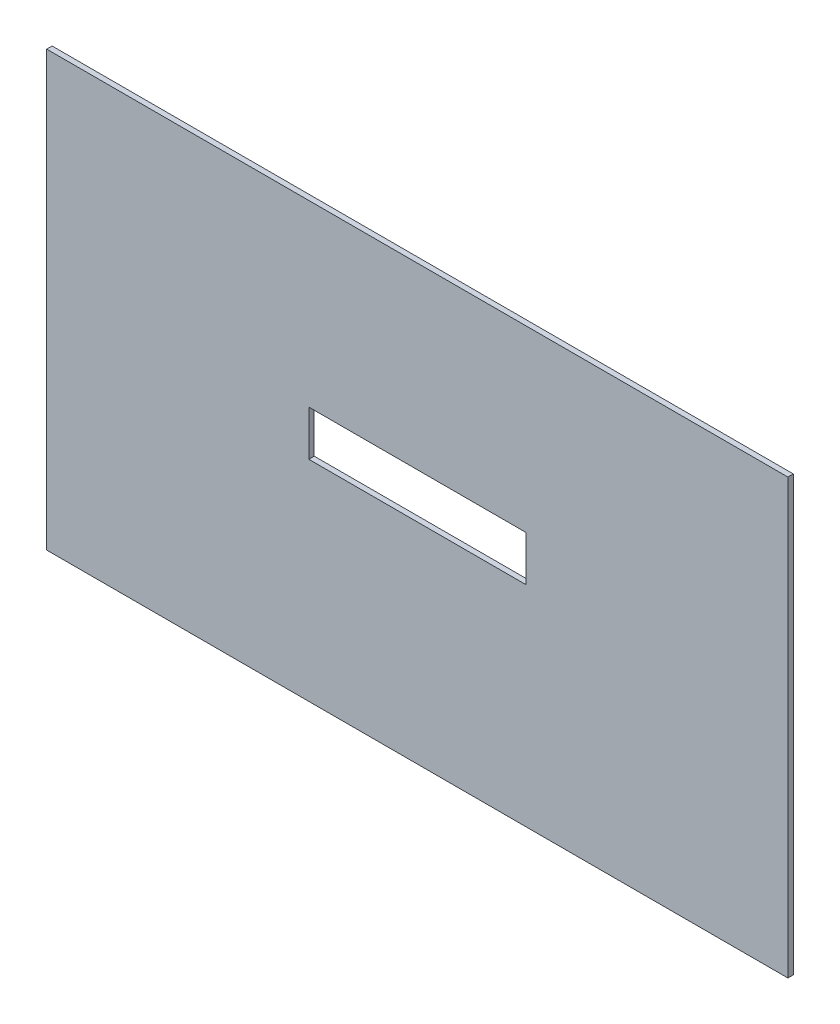
from build123d import *

# Parameters (mm, degrees)
SKETCH1_W           = 410
SKETCH1_H           = 240
BOSS_EXTRUDE1_DEPTH = 1.5
SKETCH2_W           = 120
SKETCH2_H           = 25
CUT_EXTRUDE1_DEPTH  = 238.558413869


with BuildPart() as part:
    # Sketch1 → Boss-Extrude1 (new, symmetric)
    with BuildSketch(Plane.XY):
        Rectangle(SKETCH1_W, SKETCH1_H)
    extrude(amount=BOSS_EXTRUDE1_DEPTH, both=True)

    # Sketch2 → Cut-Extrude1 (cut, through all)
    with BuildSketch(Plane.XY.offset(1.5)):
        with Locations((0, 8.5)):
            Rectangle(SKETCH2_W, SKETCH2_H)
    extrude(amount=-CUT_EXTRUDE1_DEPTH, mode=Mode.SUBTRACT)


solid = part.part
